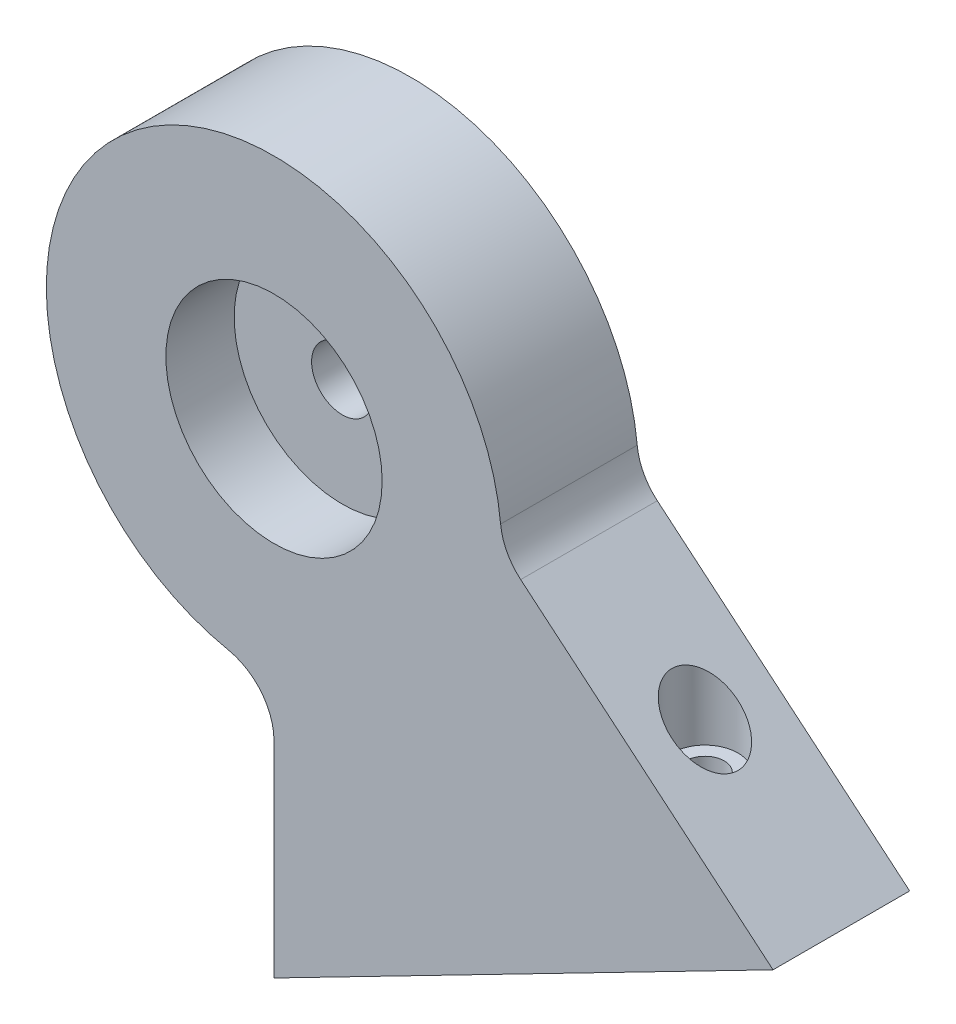
from build123d import *

# Parameters (mm, degrees)
SKETCH1_R           = 2.7
BOSS_EXTRUDE1_DEPTH = 12
FILLET1_R           = 5
SKETCH7_R           = 9.5
CUT_EXTRUDE1_DEPTH  = 6


with BuildPart() as part:
    # Sketch1 → Boss-Extrude1 (new body)
    with BuildSketch(Plane.XY):
        with BuildLine():
            Line((20, 80), (43.835071852, 60))
            Line((43.835071852, 60), (0, 37.46))
            Line((0, 37.46), (0, 60))
            ThreePointArc((0, 60), (-14.142135624, 94.142135624), (20, 80))
        make_face()
        with Locations((0, 80)):
            Circle(SKETCH1_R, mode=Mode.SUBTRACT)
    extrude(amount=BOSS_EXTRUDE1_DEPTH)

    # Sketch4 → Cut-Revolve1 (revolve, cut)
    with BuildSketch(Plane.XY.offset(6)):
        Polygon((0, 51.81611554), (-0.991858416, 49.09100694), (1.878522468, 48.046273737), (22.500457104, 40.540503357), (23.081591432, 42.137156801), (2.408353775, 49.661599954), (2.819077862, 50.79005511), align=None)
    revolve(axis=Axis((0, 48.73, 6), (-0.9396926207859095, 0.34202014332566555, 0)), mode=Mode.SUBTRACT)

    # Sketch6 → Cut-Revolve2 (revolve, cut)
    with BuildSketch(Plane.XY.offset(6)):
        Polygon((34.752985276, 66.054164426), (33.552985276, 66.054164426), (33.552985276, 45.054164426), (31.852985276, 45.054164426), (31.852985276, 78.054164426), (34.752985276, 78.054164426), align=None)
    revolve(axis=Axis((31.852985276, 39.107277093, 6), (0, 1, 0)), mode=Mode.SUBTRACT)

    # Fillet1
    fillet1_edges = [part.edges().sort_by_distance(p)[0] for p in [
        (20, 80, 6),
        (0, 60, 6),
    ]]
    fillet(fillet1_edges, radius=FILLET1_R)

    # Sketch7 → Cut-Extrude1 (cut)
    with BuildSketch(Plane.XY.offset(12)):
        with Locations((0, 80)):
            Circle(SKETCH7_R)
    extrude(amount=-CUT_EXTRUDE1_DEPTH, mode=Mode.SUBTRACT)


solid = part.part
